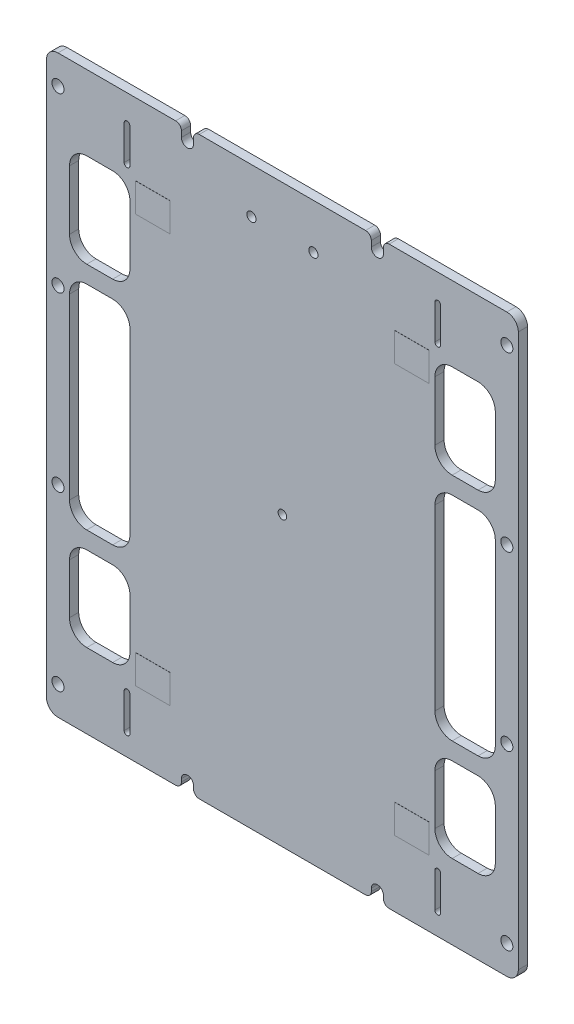
from build123d import *

# Parameters (mm, degrees)
BOARDOUTLINE_DEPTH          = 1.6
SKETCH2_R                   = 0.75
SKETCH2_R_2                 = 0.8
COMPONENTHOLES_DEPTH        = 65.680445267
SOLARCELLCONTACTHOLES_DEPTH = 1.6
WINDOWS_1SIDE_DEPTH         = 65.680445267
SKETCH5_W                   = 6
SKETCH5_H                   = 5
CONTACTPADS_DEPTH           = 0.02
M2_CLEARANCE_HOLE1_D        = 2.1
CUT_EXTRUDE1_DEPTH          = 65.680943098
FILLET3_R                   = 1
FILLET3_OF_MIRROR1_R        = 1


with BuildPart() as part:
    # Sketch1 → boardOutline (new body)
    with BuildSketch(Plane.XY):
        with BuildLine():
            Line((-39, -50), (39, -50))
            ThreePointArc((39, -50), (40.414213562, -49.414213562), (41, -48))
            Line((41, -48), (41, 48))
            ThreePointArc((41, 48), (40.414213562, 49.414213562), (39, 50))
            Line((39, 50), (-39, 50))
            ThreePointArc((-39, 50), (-40.414213562, 49.414213562), (-41, 48))
            Line((-41, 48), (-41, -48))
            ThreePointArc((-41, -48), (-40.414213562, -49.414213562), (-39, -50))
        make_face()
    extrude(amount=BOARDOUTLINE_DEPTH)

    # Sketch2 → componentHoles (cut, through all)
    with BuildSketch(Plane.XY.offset(1.6)):
        Circle(SKETCH2_R)
        with Locations((-5.38, 42.15)):
            Circle(SKETCH2_R_2)
        with Locations((5.39, 42.15)):
            Circle(SKETCH2_R_2)
    extrude(amount=-COMPONENTHOLES_DEPTH, mode=Mode.SUBTRACT)

    # Sketch4 → solarCellContactHoles (cut)
    with BuildSketch(Plane.XY.offset(1.6)):
        with BuildLine():
            Line((-27.5, 39.25), (-27.5, 45.25))
            ThreePointArc((-27.5, 45.25), (-27, 45.75), (-26.5, 45.25))
            Line((-26.5, 45.25), (-26.5, 39.25))
            ThreePointArc((-26.5, 39.25), (-27, 38.75), (-27.5, 39.25))
        make_face()
        with BuildLine():
            Line((26.5, 39.25), (26.5, 45.25))
            ThreePointArc((26.5, 45.25), (27, 45.75), (27.5, 45.25))
            Line((27.5, 45.25), (27.5, 39.25))
            ThreePointArc((27.5, 39.25), (27, 38.75), (26.5, 39.25))
        make_face()
        with BuildLine():
            Line((26.5, -46.25), (26.5, -40.25))
            ThreePointArc((26.5, -40.25), (27, -39.75), (27.5, -40.25))
            Line((27.5, -40.25), (27.5, -46.25))
            ThreePointArc((27.5, -46.25), (27, -46.75), (26.5, -46.25))
        make_face()
        with BuildLine():
            Line((-27.5, -46.25), (-27.5, -40.25))
            ThreePointArc((-27.5, -40.25), (-27, -39.75), (-26.5, -40.25))
            Line((-26.5, -40.25), (-26.5, -46.25))
            ThreePointArc((-26.5, -46.25), (-27, -46.75), (-27.5, -46.25))
        make_face()
    extrude(amount=-SOLARCELLCONTACTHOLES_DEPTH, mode=Mode.SUBTRACT)

    # Sketch3 → windows_1side (cut, through all)
    with BuildSketch(Plane.XY.offset(1.6)):
        with BuildLine():
            Line((-34, 37), (-29.5, 37))
            ThreePointArc((-29.5, 37), (-27.378679656, 36.121320344), (-26.5, 34))
            Line((-26.5, 34), (-26.5, 23.7))
            ThreePointArc((-26.5, 23.7), (-27.378679656, 21.578679656), (-29.5, 20.7))
            Line((-29.5, 20.7), (-34, 20.7))
            ThreePointArc((-34, 20.7), (-36.121320344, 21.578679656), (-37, 23.7))
            Line((-37, 23.7), (-37, 34))
            ThreePointArc((-37, 34), (-36.121320344, 36.121320344), (-34, 37))
        make_face()
        with BuildLine():
            Line((-29.5, -22.3), (-34, -22.3))
            ThreePointArc((-34, -22.3), (-36.121320344, -23.178679656), (-37, -25.3))
            Line((-37, -25.3), (-37, -34))
            ThreePointArc((-37, -34), (-36.121320344, -36.121320344), (-34, -37))
            Line((-34, -37), (-29.5, -37))
            ThreePointArc((-29.5, -37), (-27.378679656, -36.121320344), (-26.5, -34))
            Line((-26.5, -34), (-26.5, -25.3))
            ThreePointArc((-26.5, -25.3), (-27.378679656, -23.178679656), (-29.5, -22.3))
        make_face()
        with BuildLine():
            Line((-29.5, -19.3), (-34, -19.3))
            ThreePointArc((-34, -19.3), (-36.121320344, -18.421320344), (-37, -16.3))
            Line((-37, -16.3), (-37, 14.7))
            ThreePointArc((-37, 14.7), (-36.121320344, 16.821320344), (-34, 17.7))
            Line((-34, 17.7), (-29.5, 17.7))
            ThreePointArc((-29.5, 17.7), (-27.378679656, 16.821320344), (-26.5, 14.7))
            Line((-26.5, 14.7), (-26.5, -16.3))
            ThreePointArc((-26.5, -16.3), (-27.378679656, -18.421320344), (-29.5, -19.3))
        make_face()
    windows_1side = extrude(amount=-WINDOWS_1SIDE_DEPTH, mode=Mode.SUBTRACT)

    # Sketch5 → contactPads (add)
    with BuildSketch(Plane.XY.offset(1.6)):
        with Locations((-22.5, 35)):
            Rectangle(SKETCH5_W, SKETCH5_H)
        with Locations((22.5, 35)):
            Rectangle(SKETCH5_W, SKETCH5_H)
        with Locations((22.5, -36)):
            Rectangle(SKETCH5_W, SKETCH5_H)
        with Locations((-22.5, -36)):
            Rectangle(SKETCH5_W, SKETCH5_H)
    extrude(amount=CONTACTPADS_DEPTH)

    # M2 Clearance Hole1 (through all)
    with Locations(Plane(origin=(0, 0, 0), x_dir=(-1, 0, 0), z_dir=(0, 0, -1))):
        with Locations((39, 45), (39, -15), (39, -45), (39, 15)):
            m2_clearance_hole1 = Hole(M2_CLEARANCE_HOLE1_D / 2)

    # Sketch10 → Cut-Extrude1 (cut, symmetric)
    with BuildSketch(Plane(origin=(0, 0, 0), x_dir=(-1, 0, 0), z_dir=(0, 0, -1))):
        with BuildLine():
            Line((15.45, 48), (15.45, 55.073166109))
            ThreePointArc((15.45, 55.073166109), (16.5, 56.123166109), (17.55, 55.073166109))
            Line((17.55, 55.073166109), (17.55, 48))
            ThreePointArc((17.55, 48), (16.5, 46.95), (15.45, 48))
        make_face()
        with BuildLine():
            Line((17.55, -48.5), (17.55, -55.573166109))
            ThreePointArc((17.55, -55.573166109), (16.5, -56.623166109), (15.45, -55.573166109))
            Line((15.45, -55.573166109), (15.45, -48.5))
            ThreePointArc((15.45, -48.5), (16.5, -47.45), (17.55, -48.5))
        make_face()
    cut_extrude1 = extrude(amount=CUT_EXTRUDE1_DEPTH, both=True, mode=Mode.SUBTRACT)

    # Fillet3
    fillet3_edges = [part.edges().sort_by_distance(p)[0] for p in [
        (-17.55, 50, 0.8),
        (-15.45, 50, 0.8),
        (-15.45, -50, 0.8),
        (-17.55, -50, 0.8),
    ]]
    fillet(fillet3_edges, radius=FILLET3_R)

    # Mirror1: windows_1side, M2 Clearance Hole1, Cut-Extrude1 across plane
    add(windows_1side.mirror(Plane(origin=(0, 0, 0), x_dir=(0, 0, 1), z_dir=(1, 0, 0))), mode=Mode.SUBTRACT)
    add(m2_clearance_hole1.mirror(Plane(origin=(0, 0, 0), x_dir=(0, 0, 1), z_dir=(1, 0, 0))), mode=Mode.SUBTRACT)
    add(cut_extrude1.mirror(Plane(origin=(0, 0, 0), x_dir=(0, 0, 1), z_dir=(1, 0, 0))), mode=Mode.SUBTRACT)

    # Fillet3 of Mirror1
    fillet3_of_mirror1_edges = [part.edges().sort_by_distance(p)[0] for p in [
        (17.55, 50, 0.8),
        (15.45, 50, 0.8),
        (15.45, -50, 0.8),
        (17.55, -50, 0.8),
    ]]
    fillet(fillet3_of_mirror1_edges, radius=FILLET3_OF_MIRROR1_R)


solid = part.part
